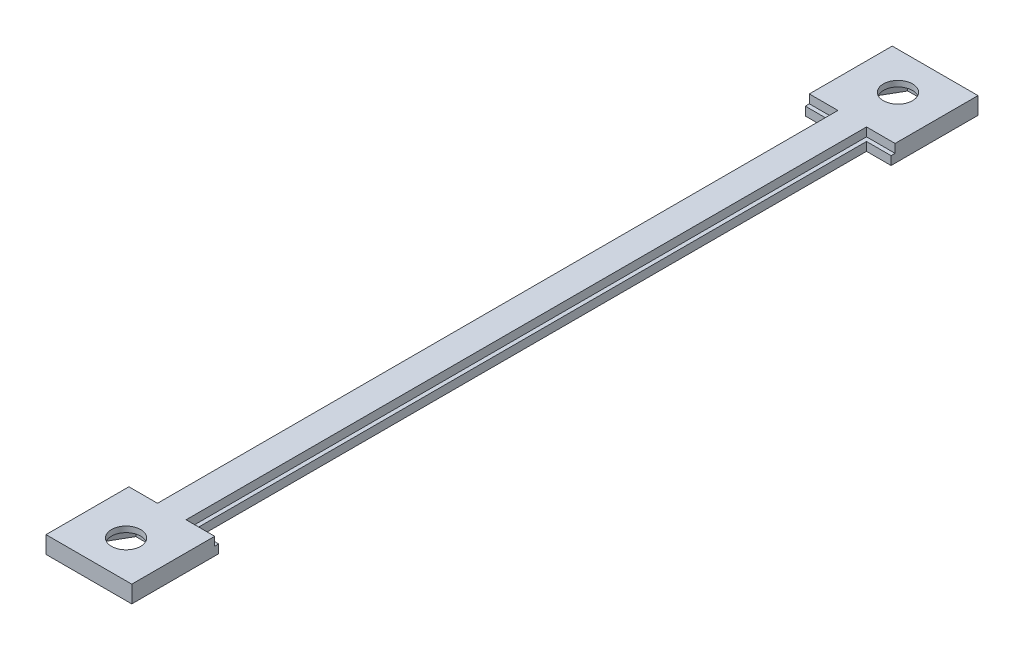
from build123d import *

# Parameters (mm, degrees)
BOSS_EXTRUDE1_DEPTH = 3
BOSS_EXTRUDE2_DEPTH = 2
SKETCH3_W           = 15
SKETCH3_H           = 1
CUT_EXTRUDE1_DEPTH  = 5
CUT_EXTRUDE2_DEPTH  = 1.5
SKETCH5_R           = 2.6
CUT_EXTRUDE3_DEPTH  = 5
CUT_EXTRUDE4_DEPTH  = 0.5
SKETCH7_W           = 6.4
SKETCH7_H           = 50
BOSS_EXTRUDE3_DEPTH = 25.5
BOSS_EXTRUDE5_DEPTH = 50
CUT_EXTRUDE5_DEPTH  = 0.5
SKETCH10_R          = 2.6
BOSS_EXTRUDE6_DEPTH = 1
BOSS_EXTRUDE7_DEPTH = 2
SKETCH12_R          = 2.55
CUT_EXTRUDE6_DEPTH  = 5
CUT_EXTRUDE7_DEPTH  = 2
SKETCH14_W          = 50
SKETCH14_H          = 28.7
CUT_EXTRUDE8_DEPTH  = 10


with BuildPart() as part:
    # Sketch1 → Boss-Extrude1 (new body)
    with BuildSketch(Plane(origin=(0, 0, 0), x_dir=(1, 0, 0), z_dir=(0, 1, 0))):
        Polygon((16.059932946, 8.246992594), (16.059932946, 23.746992594), (21.059932946, 23.746992594), (21.059932946, 142.746992594), (16.059932946, 142.746992594), (16.059932946, 158.246992594), (31.059932946, 158.246992594), (31.059932946, 142.746992594), (26.059932946, 142.746992594), (26.059932946, 23.746992594), (31.059932946, 23.746992594), (31.059932946, 8.246992594), align=None)
    extrude(amount=BOSS_EXTRUDE1_DEPTH)

    # Sketch2 → Boss-Extrude2 (add)
    with BuildSketch(Plane(origin=(0, 0, 0), x_dir=(-1, 0, 0), z_dir=(0, -1, 0))):
        Polygon((-21.059932946, 142.746992594), (-21.059932946, 23.746992594), (-16.059932946, 23.746992594), (-16.059932946, 24.446992594), (-20.359932946, 24.446992594), (-20.359932946, 142.046992594), (-16.059932946, 142.046992594), (-16.059932946, 142.746992594), align=None)
        Polygon((-31.059932946, 23.746992594), (-26.059932946, 23.746992594), (-26.059932946, 142.746992594), (-31.059932946, 142.746992594), (-31.059932946, 142.046992594), (-26.759932946, 142.046992594), (-26.759932946, 24.446992594), (-31.059932946, 24.446992594), align=None)
    extrude(amount=-BOSS_EXTRUDE2_DEPTH)

    # Sketch3 → Cut-Extrude1 (cut)
    with BuildSketch(Plane(origin=(0, 0, 0), x_dir=(-1, 0, 0), z_dir=(0, -1, 0))):
        with Locations((-23.559932946, 157.746992594)):
            Rectangle(SKETCH3_W, SKETCH3_H)
        with Locations((-23.559932946, 8.746992594)):
            Rectangle(SKETCH3_W, SKETCH3_H)
    extrude(amount=-CUT_EXTRUDE1_DEPTH, mode=Mode.SUBTRACT)

    # Sketch4 → Cut-Extrude2 (cut)
    with BuildSketch(Plane(origin=(0, 0, 0), x_dir=(-1, 0, 0), z_dir=(0, -1, 0))):
        Polygon((-19.509932946, 147.308724004), (-19.509932946, 151.985261184), (-23.559932946, 154.323529775), (-27.609932946, 151.985261184), (-27.609932946, 147.308724004), (-23.559932946, 144.970455414), align=None)
        Polygon((-23.559932946, 12.170455414), (-19.509932946, 14.508724004), (-19.509932946, 19.185261184), (-23.559932946, 21.523529775), (-27.609932946, 19.185261184), (-27.609932946, 14.508724004), align=None)
    extrude(amount=-CUT_EXTRUDE2_DEPTH, mode=Mode.SUBTRACT)

    # Sketch5 → Cut-Extrude3 (cut)
    with BuildSketch(Plane(origin=(0, 1.5, 0), x_dir=(-1, 0, 0), z_dir=(0, -1, 0))):
        with Locations((-23.559932946, 16.846992594)):
            Circle(SKETCH5_R)
        with Locations((-23.559932946, 149.646992594)):
            Circle(SKETCH5_R)
    extrude(amount=-CUT_EXTRUDE3_DEPTH, mode=Mode.SUBTRACT)

    # Sketch6 → Cut-Extrude4 (cut)
    with BuildSketch(Plane(origin=(0, 2, 0), x_dir=(1, 0, 0), z_dir=(0, 1, 0))):
        Polygon((16.059932946, 142.046992594), (16.059932946, 142.746992594), (21.059932946, 142.746992594), (21.059932946, 23.746992594), (16.059932946, 23.746992594), (16.059932946, 24.446992594), (20.359932946, 24.446992594), (20.359932946, 142.046992594), align=None)
        Polygon((31.059932946, 23.746992594), (31.059932946, 24.446992594), (26.759932946, 24.446992594), (26.759932946, 142.046992594), (31.059932946, 142.046992594), (31.059932946, 142.746992594), (26.059932946, 142.746992594), (26.059932946, 23.746992594), align=None)
    extrude(amount=-CUT_EXTRUDE4_DEPTH, mode=Mode.SUBTRACT)

    # Sketch7 → Boss-Extrude3 (add)
    with BuildSketch(Plane(origin=(0, 0, 0), x_dir=(-1, 0, 0), z_dir=(0, -1, 0))):
        with Locations((-23.559932946, 54.446992594)):
            Rectangle(SKETCH7_W, SKETCH7_H)
    extrude(amount=BOSS_EXTRUDE3_DEPTH)

    # Sketch8 → Boss-Extrude5 (add)
    with BuildSketch(Plane(origin=(0, 0, -79.446992594), x_dir=(-1, 0, 0), z_dir=(0, 0, -1))):
        with BuildLine():
            ThreePointArc((-26.759932946, -25.5), (-23.559932946, -28.7), (-20.359932946, -25.5))
            Line((-20.359932946, -25.5), (-26.759932946, -25.5))
        make_face()
    extrude(amount=-BOSS_EXTRUDE5_DEPTH)

    # Sketch9 → Cut-Extrude5 (cut)
    with BuildSketch(Plane(origin=(0, 1.5, 0), x_dir=(-1, 0, 0), z_dir=(0, -1, 0))):
        Polygon((-23.559932946, 154.323529775), (-27.609932946, 151.985261184), (-27.609932946, 147.308724004), (-23.559932946, 144.970455414), (-19.509932946, 147.308724004), (-19.509932946, 151.985261184), align=None)
        Polygon((-23.559932946, 21.523529775), (-27.609932946, 19.185261184), (-27.609932946, 14.508724004), (-23.559932946, 12.170455414), (-19.509932946, 14.508724004), (-19.509932946, 19.185261184), align=None)
    extrude(amount=-CUT_EXTRUDE5_DEPTH, mode=Mode.SUBTRACT)

    # Sketch10 → Boss-Extrude6 (add)
    with BuildSketch(Plane(origin=(0, 2, 0), x_dir=(-1, 0, 0), z_dir=(0, -1, 0))):
        with Locations((-23.559932946, 16.846992594)):
            Circle(SKETCH10_R)
        with Locations((-23.559932946, 149.646992594)):
            Circle(SKETCH10_R)
    extrude(amount=-BOSS_EXTRUDE6_DEPTH)

    # Sketch11 → Boss-Extrude7 (add)
    with BuildSketch(Plane(origin=(0, 2, 0), x_dir=(-1, 0, 0), z_dir=(0, -1, 0))):
        Polygon((-27.609932946, 14.508724004), (-23.559932946, 12.170455414), (-19.509932946, 14.508724004), (-19.509932946, 19.185261184), (-23.559932946, 21.523529775), (-27.609932946, 19.185261184), align=None)
        Polygon((-27.609932946, 151.985261184), (-27.609932946, 147.308724004), (-23.559932946, 144.970455414), (-19.509932946, 147.308724004), (-19.509932946, 151.985261184), (-23.559932946, 154.323529775), align=None)
    extrude(amount=BOSS_EXTRUDE7_DEPTH)

    # Sketch12 → Cut-Extrude6 (cut)
    with BuildSketch(Plane(origin=(0, 0, 0), x_dir=(-1, 0, 0), z_dir=(0, -1, 0))):
        with Locations((-23.559932946, 15.746992594)):
            Circle(SKETCH12_R)
        with Locations((-23.559932946, 150.746992594)):
            Circle(SKETCH12_R)
    extrude(amount=-CUT_EXTRUDE6_DEPTH, mode=Mode.SUBTRACT)

    # Sketch13 → Cut-Extrude7 (cut)
    with BuildSketch(Plane(origin=(0, 0, 0), x_dir=(-1, 0, 0), z_dir=(0, -1, 0))):
        Polygon((-28.236470127, 15.746992594), (-25.898201537, 11.696992594), (-21.221664356, 11.696992594), (-18.883395766, 15.746992594), (-21.221664356, 19.796992594), (-25.898201537, 19.796992594), align=None)
        Polygon((-28.236470127, 150.746992594), (-25.898201537, 146.696992594), (-21.221664356, 146.696992594), (-18.883395766, 150.746992594), (-21.221664356, 154.796992594), (-25.898201537, 154.796992594), align=None)
    extrude(amount=-CUT_EXTRUDE7_DEPTH, mode=Mode.SUBTRACT)

    # Sketch14 → Cut-Extrude8 (cut)
    with BuildSketch(Plane.ZY.offset(-20.359932946)):
        with Locations((-54.446992594, -14.35)):
            Rectangle(SKETCH14_W, SKETCH14_H)
    extrude(amount=-CUT_EXTRUDE8_DEPTH, mode=Mode.SUBTRACT)


solid = part.part
